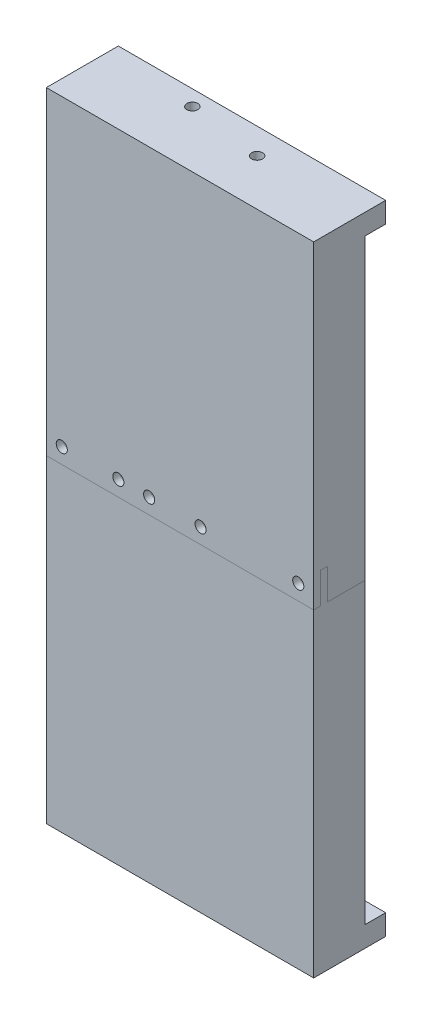
from build123d import *

# Parameters (mm, degrees)
SKETCH1_W               = 100
SKETCH1_H               = 280
BOSS_EXTRUDE1_DEPTH     = 10
SKETCH2_W               = 100
SKETCH2_H               = 10
BOSS_EXTRUDE2_DEPTH     = 10
SKETCH4_W               = 15
SKETCH4_H               = 35
SKETCH4_H_2             = 25
SKETCH4_W_2             = 10
SKETCH4_H_3             = 15
BOSS_EXTRUDE3_DEPTH     = 290
SKETCH5_W               = 10
SKETCH5_H               = 10
CUT_EXTRUDE1_DEPTH      = 15
SKETCH6_W               = 130
SKETCH6_H               = 35
BOSS_EXTRUDE4_DEPTH     = 10
SKETCH7_W               = 130
SKETCH7_H               = 35
BOSS_EXTRUDE5_DEPTH     = 10
CUT_EXTRUDE2_DEPTH      = 298.025990798
CUT_EXTRUDE2_DEPTH_BACK = 298.025990798
SKETCH15_R              = 2.7
SPLIT1_OUTLINE_W        = 130
SPLIT1_OUTLINE_H        = 140
SPLIT1_DEPTH            = 10
SPLIT1_START            = -15
SPLIT1_2_OUTLINE_R      = 2.7
SPLIT1_2_OUTLINE_W      = 10
SPLIT1_2_OUTLINE_H      = 135
SPLIT1_2_DEPTH          = 18.33
SPLIT1_START_2          = -25
SPLIT1_3_OUTLINE_R      = 2.7
SPLIT1_3_DEPTH          = 10
SPLIT1_START_3          = 6.67
SPLIT1_4_OUTLINE_W      = 130
SPLIT1_4_OUTLINE_H      = 15
SPLIT1_4_OUTLINE_R      = 2.7
SPLIT1_4_DEPTH          = 3.33
SPLIT1_5_OUTLINE_W      = 10
SPLIT1_5_OUTLINE_H      = 15
SPLIT1_5_OUTLINE_W_2    = 80
SPLIT1_5_OUTLINE_R      = 2.7
SPLIT1_5_DEPTH          = 3.33
SPLIT1_6_OUTLINE_W      = 130
SPLIT1_6_OUTLINE_H      = 140
SPLIT1_6_DEPTH          = 35
SPLIT1_7_OUTLINE_W      = 130
SPLIT1_7_OUTLINE_H      = 15
SPLIT1_7_OUTLINE_R      = 2.7
SPLIT1_7_DEPTH          = 28.33
SPLIT1_8_OUTLINE_W      = 130
SPLIT1_8_OUTLINE_H      = 15
SPLIT1_8_OUTLINE_R      = 2.7
SPLIT1_8_DEPTH          = 3.33
CUT_EXTRUDE5_DEPTH      = 328.704446471
CUT_EXTRUDE5_DEPTH_BACK = 328.704446471
SKETCH16_R              = 2.65
CUT_EXTRUDE6_START      = -5
SKETCH17_R              = 6
SKETCH17_R_2            = 2.65
CUT_EXTRUDE6_DEPTH      = 5


# Read off the part's stored shape, not the designer's step: Split1
with BuildPart() as part:
    # Sketch1 → Boss-Extrude1 (new body)
    with BuildSketch(Plane.XY):
        with Locations((38.272475697, 126.286508851)):
            Rectangle(SKETCH1_W, SKETCH1_H)
    extrude(amount=BOSS_EXTRUDE1_DEPTH)

    # Sketch2 → Boss-Extrude2 (add)
    with BuildSketch(Plane.XZ.offset(13.713491149)):
        with Locations((38.272475697, 5)):
            Rectangle(SKETCH2_W, SKETCH2_H)
    extrude(amount=BOSS_EXTRUDE2_DEPTH)

    # Sketch4 → Boss-Extrude3 (add)
    with BuildSketch(Plane.XZ.offset(23.713491149)):
        with Locations((-19.227524303, -7.5)):
            Rectangle(SKETCH4_W, SKETCH4_H)
        with Locations((95.772475697, -2.5)):
            Rectangle(SKETCH4_W, SKETCH4_H_2)
        with Locations((73.272475697, -7.5)):
            Rectangle(SKETCH4_W_2, SKETCH4_H_3)
    extrude(amount=-BOSS_EXTRUDE3_DEPTH)

    # Sketch5 → Cut-Extrude1 (cut)
    with BuildSketch(Plane(origin=(0, 0, -15), x_dir=(-1, 0, 0), z_dir=(0, 0, -1))):
        with Locations((-73.272475697, 261.286508851)):
            Rectangle(SKETCH5_W, SKETCH5_H)
        with Locations((-73.272475697, -18.713491149)):
            Rectangle(SKETCH5_W, SKETCH5_H)
    extrude(amount=-CUT_EXTRUDE1_DEPTH, mode=Mode.SUBTRACT)

    # Sketch6 → Boss-Extrude4 (add)
    with BuildSketch(Plane.XZ.offset(23.713491149)):
        with Locations((38.272475697, -7.5)):
            Rectangle(SKETCH6_W, SKETCH6_H)
    extrude(amount=BOSS_EXTRUDE4_DEPTH)

    # Sketch7 → Boss-Extrude5 (add)
    with BuildSketch(Plane(origin=(0, 266.286508851, 0), x_dir=(1, 0, 0), z_dir=(0, 1, 0))):
        with Locations((38.272475697, 7.5)):
            Rectangle(SKETCH7_W, SKETCH7_H)
    extrude(amount=BOSS_EXTRUDE5_DEPTH)

    # Sketch15 → Cut-Extrude2 (cut, two sides: drawn at the far end of the back side and taken through both)
    with BuildSketch(Plane.XY.offset(10).offset(-CUT_EXTRUDE2_DEPTH_BACK)):
        with Locations((8.272475697, 128.786508851)):
            Circle(SKETCH15_R)
        with Locations((23.272475697, 128.786508851)):
            Circle(SKETCH15_R)
        with Locations((48.272475697, 128.786508851)):
            Circle(SKETCH15_R)
        with Locations((-19.227524303, 128.786508851)):
            Circle(SKETCH15_R)
        with Locations((95.772475697, 128.786508851)):
            Circle(SKETCH15_R)
    extrude(amount=CUT_EXTRUDE2_DEPTH + CUT_EXTRUDE2_DEPTH_BACK, mode=Mode.SUBTRACT)

    # Split1 6 outline → Split1 6 (cut)
    with BuildSketch(Plane.XY.offset(SPLIT1_START_2)):
        with Locations((38.272475697, 206.286508851)):
            Rectangle(SPLIT1_6_OUTLINE_W, SPLIT1_6_OUTLINE_H)
    extrude(amount=SPLIT1_6_DEPTH, mode=Mode.SUBTRACT)

    # Split1 7 outline → Split1 7 (cut)
    with BuildSketch(Plane.XY.offset(SPLIT1_START_2)):
        with Locations((38.272475697, 128.786508851)):
            Rectangle(SPLIT1_7_OUTLINE_W, SPLIT1_7_OUTLINE_H)
        with Locations((95.772475697, 128.786508851)):
            Circle(SPLIT1_7_OUTLINE_R, mode=Mode.SUBTRACT)
        with Locations((48.272475697, 128.786508851)):
            Circle(SPLIT1_7_OUTLINE_R, mode=Mode.SUBTRACT)
        with Locations((8.272475697, 128.786508851)):
            Circle(SPLIT1_7_OUTLINE_R, mode=Mode.SUBTRACT)
        with Locations((23.272475697, 128.786508851)):
            Circle(SPLIT1_7_OUTLINE_R, mode=Mode.SUBTRACT)
        with Locations((-19.227524303, 128.786508851)):
            Circle(SPLIT1_7_OUTLINE_R, mode=Mode.SUBTRACT)
    extrude(amount=SPLIT1_7_DEPTH, mode=Mode.SUBTRACT)

    # Split1 8 outline → Split1 8 (cut)
    with BuildSketch(Plane.XY.offset(SPLIT1_START_3)):
        with Locations((38.272475697, 128.786508851)):
            Rectangle(SPLIT1_8_OUTLINE_W, SPLIT1_8_OUTLINE_H)
        with Locations((95.772475697, 128.786508851)):
            Circle(SPLIT1_8_OUTLINE_R, mode=Mode.SUBTRACT)
        with Locations((48.272475697, 128.786508851)):
            Circle(SPLIT1_8_OUTLINE_R, mode=Mode.SUBTRACT)
        with Locations((8.272475697, 128.786508851)):
            Circle(SPLIT1_8_OUTLINE_R, mode=Mode.SUBTRACT)
        with Locations((23.272475697, 128.786508851)):
            Circle(SPLIT1_8_OUTLINE_R, mode=Mode.SUBTRACT)
        with Locations((-19.227524303, 128.786508851)):
            Circle(SPLIT1_8_OUTLINE_R, mode=Mode.SUBTRACT)
    extrude(amount=SPLIT1_8_DEPTH, mode=Mode.SUBTRACT)


with BuildPart() as body_2:
    # Split1 outline → Split1 (new body)
    with BuildSketch(Plane.XY):
        with Locations((38.272475697, 206.286508851)):
            Rectangle(SPLIT1_OUTLINE_W, SPLIT1_OUTLINE_H)
    extrude(amount=SPLIT1_DEPTH)

    # Split1 2 outline → Split1 2 (add)
    # profile 1 of 2: a face of its own
    with BuildSketch(Plane.XY.offset(SPLIT1_START)):
        Polygon((88.272475697, 121.286508851), (103.272475697, 121.286508851), (103.272475697, 276.286508851), (-26.727524303, 276.286508851), (-26.727524303, 121.286508851), (-11.727524303, 121.286508851), (-11.727524303, 266.286508851), (88.272475697, 266.286508851), align=None)
        with Locations((95.772475697, 128.786508851)):
            Circle(SPLIT1_2_OUTLINE_R, mode=Mode.SUBTRACT)
        with Locations((-19.227524303, 128.786508851)):
            Circle(SPLIT1_2_OUTLINE_R, mode=Mode.SUBTRACT)
    # profile 2 of 2: a face of its own
    with BuildSketch(Plane.XY.offset(SPLIT1_START)):
        with Locations((73.272475697, 188.786508851)):
            Rectangle(SPLIT1_2_OUTLINE_W, SPLIT1_2_OUTLINE_H)
    extrude(amount=SPLIT1_2_DEPTH)

    # Split1 3 outline → Split1 3 (add)
    with BuildSketch(Plane.XY.offset(SPLIT1_START_2)):
        Polygon((103.272475697, 266.286508851), (103.272475697, 276.286508851), (-26.727524303, 276.286508851), (-26.727524303, 121.286508851), (-11.727524303, 121.286508851), (-11.727524303, 266.286508851), align=None)
        with Locations((-19.227524303, 128.786508851)):
            Circle(SPLIT1_3_OUTLINE_R, mode=Mode.SUBTRACT)
    extrude(amount=SPLIT1_3_DEPTH)

    # Split1 4 outline → Split1 4 (add)
    with BuildSketch(Plane.XY.offset(SPLIT1_START_3)):
        with Locations((38.272475697, 128.786508851)):
            Rectangle(SPLIT1_4_OUTLINE_W, SPLIT1_4_OUTLINE_H)
        with Locations((95.772475697, 128.786508851)):
            Circle(SPLIT1_4_OUTLINE_R, mode=Mode.SUBTRACT)
        with Locations((48.272475697, 128.786508851)):
            Circle(SPLIT1_4_OUTLINE_R, mode=Mode.SUBTRACT)
        with Locations((8.272475697, 128.786508851)):
            Circle(SPLIT1_4_OUTLINE_R, mode=Mode.SUBTRACT)
        with Locations((23.272475697, 128.786508851)):
            Circle(SPLIT1_4_OUTLINE_R, mode=Mode.SUBTRACT)
        with Locations((-19.227524303, 128.786508851)):
            Circle(SPLIT1_4_OUTLINE_R, mode=Mode.SUBTRACT)
    extrude(amount=SPLIT1_4_DEPTH)

    # Split1 5 outline → Split1 5 (add)
    # profile 1 of 2: a face of its own
    with BuildSketch(Plane.XY):
        with Locations((83.272475697, 128.786508851)):
            Rectangle(SPLIT1_5_OUTLINE_W, SPLIT1_5_OUTLINE_H)
    # profile 2 of 2: a face of its own
    with BuildSketch(Plane.XY):
        with Locations((28.272475697, 128.786508851)):
            Rectangle(SPLIT1_5_OUTLINE_W_2, SPLIT1_5_OUTLINE_H)
        with Locations((8.272475697, 128.786508851)):
            Circle(SPLIT1_5_OUTLINE_R, mode=Mode.SUBTRACT)
        with Locations((23.272475697, 128.786508851)):
            Circle(SPLIT1_5_OUTLINE_R, mode=Mode.SUBTRACT)
        with Locations((48.272475697, 128.786508851)):
            Circle(SPLIT1_5_OUTLINE_R, mode=Mode.SUBTRACT)
    extrude(amount=SPLIT1_5_DEPTH)


with BuildPart() as cut_extrude5_tool:
    # Sketch16 → Cut-Extrude5 (new, two sides: drawn at the far end of the back side and taken through both)
    with BuildSketch(Plane(origin=(0, 276.286508851, 0), x_dir=(1, 0, 0), z_dir=(0, 1, 0)).offset(-CUT_EXTRUDE5_DEPTH_BACK)):
        with Locations(Location((16.772475697, 17.5, 0), (0, 0, 270))):
            Circle(SKETCH16_R)
        with Locations(Location((53.272475697, 12.5, 0), (0, 0, 270))):
            Circle(SKETCH16_R)
    extrude(amount=CUT_EXTRUDE5_DEPTH + CUT_EXTRUDE5_DEPTH_BACK)


with BuildPart() as part_1:
    add(part.part)

    # Cut-Extrude5: cut by cut_extrude5_tool
    add(cut_extrude5_tool.part, mode=Mode.SUBTRACT)

    # Sketch17 → Cut-Extrude6 (cut)
    # profile 1 of 2: a face of its own
    with BuildSketch(Plane.XZ.offset(33.713491149).offset(CUT_EXTRUDE6_START)):
        with Locations(Location((53.272475697, -12.5, 0), (0, 0, 270))):
            Circle(SKETCH17_R)
        with Locations(Location((53.272475697, -12.5, 0), (0, 0, 90))):
            Circle(SKETCH17_R_2, mode=Mode.SUBTRACT)
    # profile 2 of 2: a face of its own
    with BuildSketch(Plane.XZ.offset(33.713491149).offset(CUT_EXTRUDE6_START)):
        with Locations(Location((16.772475697, -17.5, 0), (0, 0, 270))):
            Circle(SKETCH17_R)
    extrude(amount=CUT_EXTRUDE6_DEPTH, mode=Mode.SUBTRACT)


with BuildPart() as body_2_1:
    add(body_2.part)

    # Cut-Extrude5: cut by cut_extrude5_tool
    add(cut_extrude5_tool.part, mode=Mode.SUBTRACT)


solid = Compound([part_1.part, body_2_1.part])
